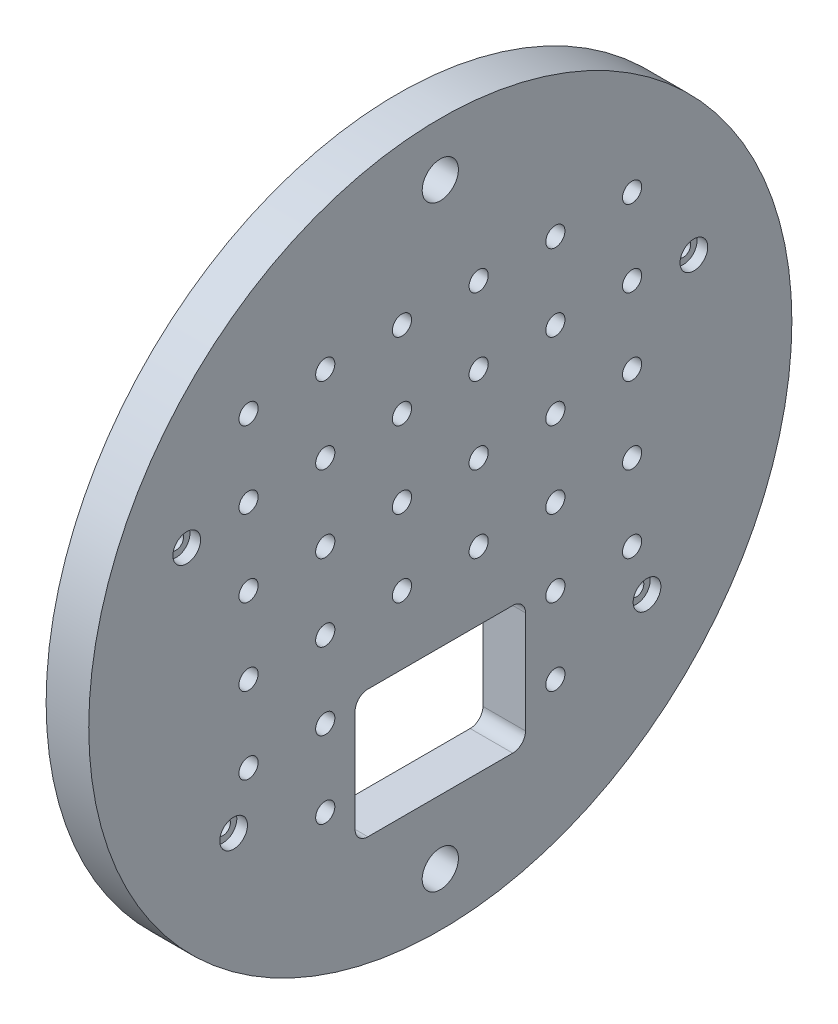
from build123d import *

# Parameters (mm, degrees)
SKETCH_1_R                  = 82.5
EXTRUDE_1_DEPTH             = 10
HOLE_WIZARD_508_D           = 3.5
HOLE_WIZARD_508_CBORE_D     = 6.5
HOLE_WIZARD_508_CBORE_DEPTH = 2.5
SKETCH_5_R                  = 4.25
CUT_EXTRUDE_867_DEPTH       = 118.100384286
CUT_EXTRUDE_1205_REACH      = 119.1
CUT_EXTRUDE_1_REACH         = 119.1
SKETCH_10_R                 = 2.25
PATTERN_LINEAR_1_COUNT      = 6
PATTERN_LINEAR_1_PITCH      = 18
PATTERN_LINEAR_1_COUNT_DIR2 = 6
PATTERN_LINEAR_1_PITCH_DIR2 = 18
WRAP_START                  = -0.3
WRAP_1_DEPTH                = 0.3


# Read off the part's stored shape, not the designer's step: 包覆1
with BuildPart() as part:
    # 草圖1 → 填料-伸長1 (new body)
    with BuildSketch(Plane(origin=(0, 0, 0), x_dir=(0, 0, -1), z_dir=(1, 0, 0))):
        Circle(SKETCH_1_R)
    extrude(amount=EXTRUDE_1_DEPTH)

    # Hole Wizard 508 (through all)
    with Locations(Plane(origin=(10, 25, -59.5), x_dir=(0, 0, 1), z_dir=(1, 0, 0))):
        with Locations((0, 0), (119, 0), (108, 63.5), (11, 63.5)):
            CounterBoreHole(HOLE_WIZARD_508_D / 2, HOLE_WIZARD_508_CBORE_D / 2, HOLE_WIZARD_508_CBORE_DEPTH)

    # 草圖5 → Cut-Extrude 867 (cut, through all)
    with BuildSketch(Plane.ZY.offset(-10)):
        with Locations((0, 70)):
            Circle(SKETCH_5_R)
        with Locations(Location((0, -70, 0), (0, 0, 180))):
            Circle(SKETCH_5_R)
    extrude(amount=CUT_EXTRUDE_867_DEPTH, mode=Mode.SUBTRACT)

    # 草圖7 → Cut-Extrude 1205 (cut, up to next)
    with BuildSketch(Plane(origin=(10, 0, 0), x_dir=(0, 0, -1), z_dir=(1, 0, 0)), mode=Mode.PRIVATE) as cut_extrude_1205_sk1:
        with BuildLine():
            Line((-17, -25), (17, -25))
            ThreePointArc((17, -25), (19.121320344, -25.878679656), (20, -28))
            Line((20, -28), (20, -52))
            ThreePointArc((20, -52), (19.121320344, -54.121320344), (17, -55))
            Line((17, -55), (-17, -55))
            ThreePointArc((-17, -55), (-19.121320344, -54.121320344), (-20, -52))
            Line((-20, -52), (-20, -28))
            ThreePointArc((-20, -28), (-19.121320344, -25.878679656), (-17, -25))
        make_face()
    cut_extrude_1205_tool1 = extrude(cut_extrude_1205_sk1.sketch, amount=-CUT_EXTRUDE_1205_REACH, mode=Mode.PRIVATE) & part.part
    add(cut_extrude_1205_tool1.solids().sort_by_distance((10, -40, 0))[0], mode=Mode.SUBTRACT)

    # 草圖10 → 除料-伸長1 (cut, up to next)
    with BuildSketch(Plane(origin=(10, 0, 0), x_dir=(0, 0, -1), z_dir=(1, 0, 0)), mode=Mode.PRIVATE) as cut_extrude_1_sk1:
        with Locations((45, 45)):
            Circle(SKETCH_10_R)
    cut_extrude_1_tool1 = extrude(cut_extrude_1_sk1.sketch, amount=-CUT_EXTRUDE_1_REACH, mode=Mode.PRIVATE) & part.part
    cut_extrude_1 = cut_extrude_1_tool1.solids().sort_by_distance((10, 45, -45))[0]
    add(cut_extrude_1, mode=Mode.SUBTRACT)

    # 直線複製排列1: Cut-Extrude 1 6 × 6, 6 skipped
    with Locations(*[(0, -j * PATTERN_LINEAR_1_PITCH_DIR2, i * PATTERN_LINEAR_1_PITCH) for i in range(PATTERN_LINEAR_1_COUNT) for j in range(PATTERN_LINEAR_1_COUNT_DIR2) if (i, j) not in ((0, 0), (0, 5), (2, 4), (2, 5), (3, 4), (3, 5), (5, 5))]):
        add(cut_extrude_1, mode=Mode.SUBTRACT)

    # 包覆1 outline → 包覆1 (cut)
    # profile 1 of 5: a face of its own
    with BuildSketch(Plane.ZY.offset(WRAP_START)):
        with BuildLine():
            add(Edge.make_bspline(
                [(4.361103869, -62.576923077), (4.363151022, -62.535252189), (4.367171576, -62.453411675), (4.385999866, -62.334087768), (4.412940743, -62.220032969), (4.451032197, -62.112163055), (4.498338475, -62.009524248), (4.555068502, -61.912524233), (4.622262352, -61.821533044), (4.698469086, -61.737394201), (4.781237726, -61.66020663), (4.870543665, -61.593551387), (4.964388692, -61.537233716), (5.062488091, -61.490152474), (5.165948655, -61.454812628), (5.273831513, -61.428590988), (5.386610649, -61.412814643), (5.463450671, -61.411118857), (5.502530151, -61.41025641)],
                knots=[0, 0, 0, 0, 0.068790794, 0.135103289, 0.198978674, 0.2619043, 0.323494969, 0.385195378, 0.446969239, 0.509764777, 0.572250569, 0.633405176, 0.693251163, 0.752583163, 0.812579266, 0.873275085, 0.935549943, 1, 1, 1, 1], degree=3))
            Line((4.361103869, -62.576923077), (4.675206433, -62.576923077))
            add(Edge.make_bspline(
                [(5.48640435, -61.769230769), (5.459033517, -61.769945801), (5.405281721, -61.771350007), (5.326362688, -61.781172671), (5.251076911, -61.798118511), (5.179235008, -61.821295186), (5.110715422, -61.850753734), (5.045851378, -61.887445479), (4.984788488, -61.931228972), (4.927411965, -61.980869529), (4.874547986, -62.03613713), (4.82810111, -62.097747093), (4.787517096, -62.164574508), (4.752107863, -62.236439059), (4.723352173, -62.313992839), (4.701379022, -62.396960544), (4.683992175, -62.484981925), (4.678183655, -62.54576701), (4.675206433, -62.576923077)],
                knots=[0, 0, 0, 0, 0.064438672, 0.126546911, 0.186887153, 0.245877536, 0.304040885, 0.362191218, 0.420975933, 0.480660283, 0.540600275, 0.600689098, 0.66193579, 0.724442506, 0.789038394, 0.856313757, 0.926352028, 1, 1, 1, 1], degree=3))
            add(Edge.make_bspline(
                [(6.245719254, -62.478766026), (6.245083512, -62.454884627), (6.243830586, -62.407818977), (6.232772888, -62.338813218), (6.216062382, -62.272248404), (6.192117124, -62.207919785), (6.160510384, -62.146474133), (6.122037004, -62.087836653), (6.07764694, -62.031147687), (6.026295671, -61.977994389), (5.969884151, -61.929313184), (5.910289902, -61.886189098), (5.847239798, -61.850149988), (5.780999675, -61.820606491), (5.711754206, -61.797431109), (5.639369461, -61.78137253), (5.564045445, -61.771290046), (5.512611949, -61.769925874), (5.48640435, -61.769230769)],
                knots=[0, 0, 0, 0, 0.061965401, 0.122121906, 0.180988497, 0.239933216, 0.299905831, 0.359988847, 0.421775742, 0.486575826, 0.551534805, 0.615017543, 0.677258617, 0.739729962, 0.803050103, 0.866495132, 0.931973474, 1, 1, 1, 1], degree=3))
            add(Edge.make_bspline(
                [(5.583860279, -63.551482372), (5.616908166, -63.516984065), (5.680386393, -63.450719879), (5.77016897, -63.353976919), (5.850807959, -63.264227378), (5.922825351, -63.181640829), (5.984658857, -63.105009262), (6.039531089, -63.036814558), (6.08349668, -62.974060108), (6.131212075, -62.901319494), (6.177426057, -62.812507177), (6.217138413, -62.703973487), (6.241353261, -62.592246235), (6.244258097, -62.516744198), (6.245719254, -62.478766026)],
                knots=[0, 0, 0, 0, 0.110802644, 0.212829202, 0.30610131, 0.390647321, 0.466924469, 0.534481039, 0.593586941, 0.644557005, 0.736200453, 0.825024026, 0.911985585, 1, 1, 1, 1], degree=3))
            Line((5.583860279, -63.551482372), (4.226488485, -65))
            Line((4.226488485, -65), (6.604693613, -65))
            Line((6.604693613, -65), (6.604693613, -64.641025641))
            Line((6.604693613, -64.641025641), (4.975987683, -64.641025641))
            Line((4.975987683, -64.641025641), (5.851688805, -63.706430288))
            add(Edge.make_bspline(
                [(6.559821818, -62.450721154), (6.558128555, -62.499468988), (6.554771744, -62.596109202), (6.526057367, -62.738124065), (6.481210856, -62.875717484), (6.427213499, -62.986454786), (6.372741055, -63.07568828), (6.323653548, -63.149156985), (6.266188737, -63.228262453), (6.199510239, -63.31273979), (6.124997366, -63.403250696), (6.041975203, -63.499740491), (5.949851721, -63.601212261), (5.88519322, -63.670517862), (5.851688805, -63.706430288)],
                knots=[0, 0, 0, 0, 0.098702196, 0.195672309, 0.292422427, 0.391342544, 0.444462441, 0.504228775, 0.570352338, 0.642545753, 0.722287505, 0.807921123, 0.900469538, 1, 1, 1, 1], degree=3))
            add(Edge.make_bspline(
                [(5.502530151, -61.41025641), (5.540908225, -61.411154867), (5.61631977, -61.412920302), (5.726381784, -61.428081331), (5.831159079, -61.451826922), (5.930446845, -61.485142339), (6.02345291, -61.529926766), (6.110875955, -61.583724305), (6.193756765, -61.645944136), (6.268363549, -61.71919795), (6.336871628, -61.797400334), (6.395973883, -61.880888238), (6.446587047, -61.967117523), (6.488774727, -62.056745725), (6.519830866, -62.150616753), (6.543409074, -62.247363956), (6.556736487, -62.347988767), (6.558781911, -62.416095323), (6.559821818, -62.450721154)],
                knots=[0, 0, 0, 0, 0.06947546, 0.136516798, 0.200788824, 0.263829673, 0.325735023, 0.387290692, 0.449509219, 0.51296782, 0.576275215, 0.6375801, 0.697902606, 0.757172088, 0.816598528, 0.876653171, 0.937289642, 1, 1, 1, 1], degree=3))
        make_face()
    # profile 2 of 5: a face of its own
    with BuildSketch(Plane.ZY.offset(WRAP_START)):
        with BuildLine():
            add(Edge.make_bspline(
                [(3.688026946, -64.338842147), (3.665790351, -64.378285479), (3.622526742, -64.455026582), (3.548125995, -64.560458442), (3.470133922, -64.655306158), (3.385029954, -64.737035812), (3.295360275, -64.808287197), (3.20062762, -64.870625022), (3.100338802, -64.923743542), (2.994489078, -64.96849607), (2.882189527, -65.002905564), (2.76316801, -65.027209785), (2.637196515, -65.042233054), (2.550850335, -65.043978194), (2.506636722, -65.044871795)],
                knots=[0, 0, 0, 0, 0.093369857, 0.181660766, 0.265874227, 0.346354784, 0.424599862, 0.501903184, 0.579992091, 0.658443431, 0.738672236, 0.821894148, 0.908800792, 1, 1, 1, 1], degree=3))
            Line((3.688026946, -64.338842147), (3.408980472, -64.192307692))
            add(Edge.make_bspline(
                [(2.467373901, -64.730769231), (2.498725049, -64.730161174), (2.56093174, -64.728954673), (2.653572597, -64.717222762), (2.744712125, -64.698252487), (2.833973108, -64.672362496), (2.919543954, -64.640785644), (2.998789504, -64.602682787), (3.071669719, -64.56053304), (3.139786686, -64.512323365), (3.205857679, -64.453315178), (3.271400166, -64.379679457), (3.341676819, -64.292591929), (3.385666412, -64.227046263), (3.408980472, -64.192307692)],
                knots=[0, 0, 0, 0, 0.082592263, 0.163878894, 0.24565874, 0.327725695, 0.408609961, 0.485749086, 0.559169056, 0.630268476, 0.705306028, 0.792064966, 0.889796437, 1, 1, 1, 1], degree=3))
            add(Edge.make_bspline(
                [(1.534180792, -63.788461538), (1.535720399, -63.822162003), (1.538747973, -63.888432606), (1.552863116, -63.98540339), (1.57511189, -64.077776732), (1.606380952, -64.164859774), (1.644247798, -64.247789901), (1.690633514, -64.325951938), (1.745973068, -64.398989868), (1.807698768, -64.467557006), (1.876405863, -64.528617767), (1.94868861, -64.583269543), (2.025582175, -64.62907514), (2.106480259, -64.66625503), (2.191252044, -64.695361346), (2.279924239, -64.715229166), (2.372322355, -64.728536273), (2.435308089, -64.730015939), (2.467373901, -64.730769231)],
                knots=[0, 0, 0, 0, 0.068384615, 0.134475588, 0.198391058, 0.260753477, 0.321829223, 0.383037238, 0.444653123, 0.507398011, 0.569825238, 0.630777641, 0.690928687, 0.750945133, 0.811049477, 0.872330853, 0.935004094, 1, 1, 1, 1], degree=3))
            Line((1.534180792, -63.788461538), (3.822642331, -63.788461538))
            add(Edge.make_bspline(
                [(3.544296978, -62.900841346), (3.566423917, -62.931044928), (3.61053051, -62.991251046), (3.66577761, -63.089422203), (3.713735005, -63.192132798), (3.752067966, -63.301043095), (3.783107467, -63.414862675), (3.805564286, -63.53440522), (3.818733904, -63.659635131), (3.821322602, -63.744961686), (3.822642331, -63.788461538)],
                knots=[0, 0, 0, 0, 0.11852184, 0.236254763, 0.356174434, 0.477249655, 0.601539871, 0.729618382, 0.862158266, 1, 1, 1, 1], degree=3))
            add(Edge.make_bspline(
                [(2.514349062, -62.397435897), (2.566796667, -62.398789946), (2.669686913, -62.401446282), (2.819719034, -62.426072615), (2.96167975, -62.46512517), (3.095512255, -62.52027896), (3.221230115, -62.591438512), (3.338016165, -62.679580353), (3.447867678, -62.781998441), (3.511776256, -62.86076165), (3.544296978, -62.900841346)],
                knots=[0, 0, 0, 0, 0.132040234, 0.259032841, 0.381879824, 0.502258444, 0.62275219, 0.744742632, 0.870108927, 1, 1, 1, 1], degree=3))
            add(Edge.make_bspline(
                [(1.514549382, -62.874198718), (1.546257065, -62.836329848), (1.608668011, -62.761791697), (1.714224367, -62.663853372), (1.828524563, -62.581809596), (1.950136189, -62.51380246), (2.080472663, -62.462128813), (2.217781954, -62.423621231), (2.363627541, -62.40204322), (2.463332761, -62.398995386), (2.514349062, -62.397435897)],
                knots=[0, 0, 0, 0, 0.128835254, 0.253589335, 0.374643257, 0.495340042, 0.616324775, 0.739759335, 0.86684232, 1, 1, 1, 1], degree=3))
            add(Edge.make_bspline(
                [(1.220078228, -63.728165064), (1.22113737, -63.688870234), (1.223236448, -63.610993069), (1.236467235, -63.495727524), (1.259915528, -63.383699072), (1.292091852, -63.274814624), (1.333643098, -63.16925649), (1.384475318, -63.066960426), (1.444667695, -62.968035287), (1.491140369, -62.905632153), (1.514549382, -62.874198718)],
                knots=[0, 0, 0, 0, 0.128044808, 0.2537679, 0.377428427, 0.500550841, 0.623295883, 0.746578332, 0.872347541, 1, 1, 1, 1], degree=3))
            add(Edge.make_bspline(
                [(2.506636722, -65.044871795), (2.457494744, -65.04372462), (2.361632983, -65.041486813), (2.222093235, -65.022194348), (2.090713817, -64.99072199), (1.967502114, -64.946756448), (1.852759861, -64.889329124), (1.746259006, -64.819369642), (1.64743948, -64.737237388), (1.559415271, -64.642220944), (1.480171389, -64.540538987), (1.410245569, -64.434583102), (1.351788138, -64.324619878), (1.304235527, -64.211349354), (1.265830662, -64.09548546), (1.239063959, -63.975973993), (1.223634211, -63.853138408), (1.221269765, -63.770041073), (1.220078228, -63.728165064)],
                knots=[0, 0, 0, 0, 0.071578658, 0.139629225, 0.204796697, 0.268134963, 0.329813747, 0.391301398, 0.453433515, 0.51655169, 0.579631271, 0.641118921, 0.701294047, 0.760810336, 0.819931722, 0.878919575, 0.938982822, 1, 1, 1, 1], degree=3))
        make_face()
        with BuildLine():
            add(Edge.make_bspline(
                [(2.530474863, -62.711538462), (2.499125424, -62.712150133), (2.437154175, -62.713359279), (2.345853107, -62.724829408), (2.258173408, -62.743789253), (2.173468121, -62.76975421), (2.092847252, -62.804362812), (2.014652484, -62.844946039), (1.940872088, -62.894487623), (1.894730792, -62.932246478), (1.871420376, -62.951322115)],
                knots=[0, 0, 0, 0, 0.131091976, 0.259141276, 0.384161763, 0.505991952, 0.629098089, 0.750669123, 0.874038938, 1, 1, 1, 1], degree=3))
            add(Edge.make_bspline(
                [(3.508539767, -63.474358974), (3.497043142, -63.432696101), (3.474915841, -63.35250848), (3.428679476, -63.24146759), (3.376607935, -63.142779689), (3.314986204, -63.057200056), (3.245167478, -62.981196543), (3.164522296, -62.914777957), (3.074086402, -62.855360506), (2.974327262, -62.805208007), (2.868685477, -62.762518148), (2.758079285, -62.733893032), (2.645221497, -62.71428349), (2.56888721, -62.712457382), (2.530474863, -62.711538462)],
                knots=[0, 0, 0, 0, 0.096240125, 0.185231261, 0.267500523, 0.344400382, 0.419594869, 0.496890627, 0.576637919, 0.660267852, 0.745386615, 0.830040327, 0.914474212, 1, 1, 1, 1], degree=3))
            Line((3.508539767, -63.474358974), (1.567133517, -63.474358974))
            add(Edge.make_bspline(
                [(1.871420376, -62.951322115), (1.854727094, -62.966416431), (1.820943959, -62.996963647), (1.775803438, -63.049592854), (1.732582965, -63.106344416), (1.693249313, -63.16938954), (1.657171726, -63.238010319), (1.623411749, -63.311627955), (1.593025337, -63.390801085), (1.575929227, -63.445973524), (1.567133517, -63.474358974)],
                knots=[0, 0, 0, 0, 0.109983845, 0.222580497, 0.338499871, 0.458708565, 0.585535346, 0.717517743, 0.85466682, 1, 1, 1, 1], degree=3))
        make_face(mode=Mode.SUBTRACT)
    # profile 3 of 5: a face of its own
    with BuildSketch(Plane.ZY.offset(WRAP_START)):
        with BuildLine():
            add(Edge.make_bspline(
                [(0.423603869, -62.980769231), (0.405213366, -62.959456084), (0.36975864, -62.918366847), (0.313527159, -62.863429781), (0.257503555, -62.817292842), (0.202454742, -62.778340583), (0.146996473, -62.748891436), (0.091779555, -62.727396574), (0.036746816, -62.714094769), (-3.9219e-05, -62.71238033), (-0.018102862, -62.711538462)],
                knots=[0, 0, 0, 0, 0.158223098, 0.305035505, 0.441308964, 0.565963227, 0.683525114, 0.79333413, 0.898517512, 1, 1, 1, 1], degree=3))
            Line((0.423603869, -62.980769231), (0.636744895, -62.761318109))
            add(Edge.make_bspline(
                [(-0.018102862, -62.397435897), (0.009089202, -62.398540238), (0.063983424, -62.400769636), (0.14633805, -62.418475326), (0.228571392, -62.447608431), (0.310894742, -62.487844664), (0.392705031, -62.53991154), (0.474721888, -62.602840839), (0.557929918, -62.676218554), (0.609886231, -62.732317779), (0.636744895, -62.761318109)],
                knots=[0, 0, 0, 0, 0.105714261, 0.213411613, 0.32612673, 0.444451672, 0.56906108, 0.702712204, 0.846317947, 1, 1, 1, 1], degree=3))
            add(Edge.make_bspline(
                [(-0.664537156, -63.068409455), (-0.664002961, -63.044784057), (-0.662957465, -62.998545806), (-0.654613414, -62.930606986), (-0.639421702, -62.866058832), (-0.62036678, -62.803931969), (-0.593883775, -62.745429875), (-0.56223787, -62.689772404), (-0.525050445, -62.637036486), (-0.482207154, -62.588033354), (-0.435100509, -62.543524028), (-0.384205739, -62.5047254), (-0.330667483, -62.471619045), (-0.274259063, -62.443853884), (-0.21443859, -62.422852502), (-0.151624204, -62.408395117), (-0.085943049, -62.398739914), (-0.041041923, -62.397876829), (-0.018102862, -62.397435897)],
                knots=[0, 0, 0, 0, 0.06797849, 0.133043535, 0.196507438, 0.258613417, 0.319728338, 0.380872854, 0.442635602, 0.505079304, 0.56788052, 0.628813854, 0.688910091, 0.748765006, 0.809385783, 0.870884336, 0.934037463, 1, 1, 1, 1], degree=3))
            add(Edge.make_bspline(
                [(-0.547449817, -63.462439904), (-0.565580416, -63.433294289), (-0.601847952, -63.374992874), (-0.637063143, -63.277682397), (-0.661269172, -63.175237339), (-0.663431562, -63.104550485), (-0.664537156, -63.068409455)],
                knots=[0, 0, 0, 0, 0.246252371, 0.492590796, 0.740569991, 1, 1, 1, 1], degree=3))
            add(Edge.make_bspline(
                [(-0.106444208, -63.811598558), (-0.132490848, -63.797059426), (-0.183003595, -63.76886341), (-0.254550886, -63.724947329), (-0.31909824, -63.680280055), (-0.378198815, -63.637367216), (-0.430359821, -63.593946272), (-0.475375769, -63.54996902), (-0.515018985, -63.507209034), (-0.536966396, -63.476911737), (-0.547449817, -63.462439904)],
                knots=[0, 0, 0, 0, 0.157761664, 0.305950213, 0.443775499, 0.572824362, 0.692154156, 0.802295707, 0.905564392, 1, 1, 1, 1], degree=3))
            add(Edge.make_bspline(
                [(0.281276145, -64.075220353), (0.27325375, -64.06618499), (0.255778078, -64.046502708), (0.223722837, -64.01807763), (0.185340975, -63.98743953), (0.140200812, -63.955107941), (0.08821135, -63.921509336), (0.029161874, -63.886819984), (-0.036138678, -63.849392258), (-0.08230931, -63.824572603), (-0.106444208, -63.811598558)],
                knots=[0, 0, 0, 0, 0.076875074, 0.167461676, 0.272270023, 0.389550841, 0.520801368, 0.666263293, 0.825544915, 1, 1, 1, 1], degree=3))
            add(Edge.make_bspline(
                [(0.367514126, -64.319210737), (0.366427831, -64.296901119), (0.364283089, -64.252853763), (0.347439817, -64.189103422), (0.320826964, -64.128634141), (0.294622316, -64.093244494), (0.281276145, -64.075220353)],
                knots=[0, 0, 0, 0, 0.253475435, 0.500453315, 0.745578135, 1, 1, 1, 1], degree=3))
            add(Edge.make_bspline(
                [(-0.08400831, -64.730769231), (-0.053690384, -64.729398406), (0.005545757, -64.726720044), (0.090389516, -64.702402952), (0.168728142, -64.664273), (0.236751488, -64.610188302), (0.294653649, -64.547232729), (0.336581823, -64.47631861), (0.362857999, -64.399527153), (0.365943997, -64.346294851), (0.367514126, -64.319210737)],
                knots=[0, 0, 0, 0, 0.134042046, 0.261895674, 0.387836045, 0.517686206, 0.644508654, 0.764718263, 0.880290782, 1, 1, 1, 1], degree=3))
            add(Edge.make_bspline(
                [(-0.590919368, -64.461538462), (-0.571146955, -64.482893226), (-0.532815143, -64.524292666), (-0.471513926, -64.579417007), (-0.409134525, -64.625618278), (-0.346299838, -64.664261693), (-0.282079744, -64.694037096), (-0.21683413, -64.71495569), (-0.150695706, -64.728399882), (-0.10627357, -64.729978164), (-0.08400831, -64.730769231)],
                knots=[0, 0, 0, 0, 0.147475818, 0.285904172, 0.417171648, 0.540500744, 0.659237718, 0.775006098, 0.887228573, 1, 1, 1, 1], degree=3))
            Line((-0.590919368, -64.461538462), (-0.799152541, -64.698517628))
            add(Edge.make_bspline(
                [(-0.067882509, -65.044871795), (-0.103249684, -65.043879095), (-0.173492611, -65.041907487), (-0.277382331, -65.023401426), (-0.378903089, -64.994606032), (-0.477286629, -64.954890098), (-0.570332743, -64.904739385), (-0.655463668, -64.844676992), (-0.73297513, -64.776686994), (-0.777093404, -64.724574084), (-0.799152541, -64.698517628)],
                knots=[0, 0, 0, 0, 0.126742519, 0.251723961, 0.377218688, 0.504693549, 0.631458239, 0.755401067, 0.877700534, 1, 1, 1, 1], degree=3))
            add(Edge.make_bspline(
                [(0.68161669, -64.305889423), (0.680897156, -64.331158569), (0.679479236, -64.380954182), (0.669621169, -64.454289012), (0.652666193, -64.52442357), (0.629572439, -64.592118854), (0.598388066, -64.656077794), (0.561840269, -64.717914043), (0.517965357, -64.776289974), (0.467873981, -64.831128934), (0.413028487, -64.881214681), (0.354522349, -64.925238635), (0.292283518, -64.961812972), (0.226756717, -64.992078318), (0.157793063, -65.016146576), (0.085381774, -65.032809107), (0.009753019, -65.042781868), (-0.041676789, -65.044166344), (-0.067882509, -65.044871795)],
                knots=[0, 0, 0, 0, 0.064548126, 0.127199133, 0.188597338, 0.248639515, 0.309524699, 0.370036991, 0.431889244, 0.495704286, 0.559519328, 0.62137158, 0.682397107, 0.743568482, 0.805498484, 0.868639701, 0.933066225, 1, 1, 1, 1], degree=3))
            add(Edge.make_bspline(
                [(0.562425985, -63.910456731), (0.580636512, -63.940122819), (0.616878841, -63.99916384), (0.654937108, -64.096382267), (0.676997383, -64.19949277), (0.680059603, -64.27002499), (0.68161669, -64.305889423)],
                knots=[0, 0, 0, 0, 0.248838614, 0.495235025, 0.743335604, 1, 1, 1, 1], degree=3))
            add(Edge.make_bspline(
                [(0.101788965, -63.551482372), (0.129002542, -63.566727275), (0.181570213, -63.596175407), (0.25626298, -63.641885111), (0.324050021, -63.687316535), (0.385505688, -63.731983809), (0.439447497, -63.777136676), (0.48751205, -63.821044433), (0.528500494, -63.865033742), (0.551454421, -63.895766855), (0.562425985, -63.910456731)],
                knots=[0, 0, 0, 0, 0.158989101, 0.307114592, 0.446213159, 0.574876072, 0.69415211, 0.80458118, 0.906593319, 1, 1, 1, 1], degree=3))
            add(Edge.make_bspline(
                [(-0.26349549, -63.287860577), (-0.255531996, -63.297645161), (-0.238582703, -63.318470416), (-0.206774188, -63.347374269), (-0.170751685, -63.37931652), (-0.127431748, -63.411253357), (-0.07868072, -63.444885082), (-0.023441435, -63.478887215), (0.036533069, -63.51585164), (0.079470376, -63.539296076), (0.101788965, -63.551482372)],
                knots=[0, 0, 0, 0, 0.083425105, 0.177559821, 0.28398236, 0.402216747, 0.53356848, 0.676120994, 0.831649373, 1, 1, 1, 1], degree=3))
            add(Edge.make_bspline(
                [(-0.350434592, -63.055789263), (-0.34932378, -63.076001307), (-0.347105287, -63.116368418), (-0.329858608, -63.175916452), (-0.302392535, -63.23397349), (-0.276722341, -63.269536396), (-0.26349549, -63.287860577)],
                knots=[0, 0, 0, 0, 0.240039931, 0.479403194, 0.731756739, 1, 1, 1, 1], degree=3))
            add(Edge.make_bspline(
                [(-0.018102862, -62.711538462), (-0.040242251, -62.712613335), (-0.083809437, -62.714728532), (-0.146235256, -62.735841963), (-0.204185881, -62.768250701), (-0.254342861, -62.814219285), (-0.296830541, -62.866983554), (-0.327844222, -62.925979878), (-0.346810205, -62.989427922), (-0.349214937, -63.03345778), (-0.350434592, -63.055789263)],
                knots=[0, 0, 0, 0, 0.124958493, 0.245900629, 0.36916603, 0.498510841, 0.628503866, 0.751028329, 0.873724174, 1, 1, 1, 1], degree=3))
        make_face()
    # profile 4 of 5: a face of its own
    with BuildSketch(Plane.ZY.offset(WRAP_START)):
        with BuildLine():
            add(Edge.make_bspline(
                [(-1.606844849, -64.557592147), (-1.642263639, -64.597631741), (-1.711383855, -64.675769512), (-1.826824973, -64.777851685), (-1.949193151, -64.862230007), (-2.077894472, -64.930379922), (-2.212812715, -64.981571979), (-2.353648802, -65.017958138), (-2.500460183, -65.041351973), (-2.600712538, -65.043687995), (-2.651516323, -65.044871795)],
                knots=[0, 0, 0, 0, 0.134298379, 0.262084975, 0.386269912, 0.507164597, 0.627300236, 0.748144942, 0.872370177, 1, 1, 1, 1], degree=3))
            Line((-1.606844849, -64.557592147), (-1.606844849, -65))
            Line((-1.606844849, -65), (-1.292742285, -65))
            Line((-1.292742285, -65), (-1.292742285, -62.442307692))
            Line((-1.292742285, -62.442307692), (-1.606844849, -62.442307692))
            Line((-1.606844849, -62.442307692), (-1.606844849, -62.915564904))
            add(Edge.make_bspline(
                [(-2.641700618, -62.397435897), (-2.589500759, -62.398873649), (-2.487139299, -62.401693012), (-2.33741129, -62.425155739), (-2.195766812, -62.464794206), (-2.06111246, -62.518711704), (-1.933931774, -62.590360433), (-1.815428789, -62.680740394), (-1.704363306, -62.789281581), (-1.639983014, -62.872652026), (-1.606844849, -62.915564904)],
                knots=[0, 0, 0, 0, 0.129862142, 0.254653531, 0.376014554, 0.495255252, 0.614797719, 0.738105554, 0.8651963, 1, 1, 1, 1], degree=3))
            add(Edge.make_bspline(
                [(-3.985049977, -63.714142628), (-3.983797006, -63.669678925), (-3.981319949, -63.581776581), (-3.962866729, -63.452497883), (-3.93183572, -63.327979623), (-3.888287873, -63.208622679), (-3.832445918, -63.094282629), (-3.764517831, -62.984878604), (-3.684498706, -62.880109207), (-3.592246299, -62.78243798), (-3.492311529, -62.692217366), (-3.385402798, -62.61380832), (-3.274179516, -62.546091471), (-3.156916506, -62.492437995), (-3.035349401, -62.449028891), (-2.908395955, -62.418995922), (-2.776584377, -62.401298601), (-2.687093885, -62.398735837), (-2.641700618, -62.397435897)],
                knots=[0, 0, 0, 0, 0.063774532, 0.12607881, 0.186904093, 0.247573935, 0.308003356, 0.369131898, 0.432033228, 0.496790794, 0.561610823, 0.624913866, 0.686726349, 0.748078833, 0.809582291, 0.871630743, 0.934885821, 1, 1, 1, 1], degree=3))
            add(Edge.make_bspline(
                [(-2.651516323, -65.044871795), (-2.696684277, -65.043645423), (-2.785757482, -65.041226962), (-2.916786559, -65.022464659), (-3.042878808, -64.992334037), (-3.164153381, -64.950433147), (-3.279825526, -64.894852326), (-3.390885623, -64.828311078), (-3.496758315, -64.749070248), (-3.595829854, -64.658482219), (-3.687061855, -64.560087232), (-3.767123127, -64.455141685), (-3.833876207, -64.344099381), (-3.889696288, -64.228366227), (-3.932692632, -64.107051308), (-3.962666266, -63.98057414), (-3.981406713, -63.849084266), (-3.983824174, -63.759544743), (-3.985049977, -63.714142628)],
                knots=[0, 0, 0, 0, 0.064619991, 0.127433484, 0.189004127, 0.249930071, 0.310668454, 0.372328961, 0.43493911, 0.499575544, 0.564191208, 0.626735217, 0.688109334, 0.749293607, 0.810330528, 0.87190117, 0.935045915, 1, 1, 1, 1], degree=3))
        make_face()
        with BuildLine():
            add(Edge.make_bspline(
                [(-3.670947413, -63.717648237), (-3.66908252, -63.761238344), (-3.665360043, -63.8482477), (-3.638609348, -63.977228277), (-3.593729475, -64.102882319), (-3.532487412, -64.224143313), (-3.455800787, -64.336727413), (-3.366912135, -64.438467536), (-3.264961853, -64.525957124), (-3.152034346, -64.599194697), (-3.031426376, -64.658357218), (-2.904592445, -64.699522858), (-2.773916806, -64.726100638), (-2.685064473, -64.729205115), (-2.640298374, -64.730769231)],
                knots=[0, 0, 0, 0, 0.081589349, 0.162858895, 0.245483689, 0.330807139, 0.416493374, 0.499893203, 0.583048156, 0.667157852, 0.751311929, 0.833784789, 0.916256489, 1, 1, 1, 1], degree=3))
            add(Edge.make_bspline(
                [(-2.637493887, -62.711538462), (-2.683408225, -62.713172099), (-2.774035825, -62.71639664), (-2.907079827, -62.741570135), (-3.034393241, -62.78345473), (-3.155339315, -62.840736631), (-3.268007532, -62.912765368), (-3.368701203, -62.999886751), (-3.458243904, -63.099723765), (-3.533552168, -63.211825875), (-3.594942665, -63.332003967), (-3.638109697, -63.457628405), (-3.666578945, -63.586433382), (-3.669487465, -63.673796068), (-3.670947413, -63.717648237)],
                knots=[0, 0, 0, 0, 0.085920517, 0.169593435, 0.252475515, 0.336244477, 0.419504521, 0.502035907, 0.584774648, 0.669846475, 0.754184866, 0.836658238, 0.918009726, 1, 1, 1, 1], degree=3))
            add(Edge.make_bspline(
                [(-1.606844849, -63.726762821), (-1.607804505, -63.69142499), (-1.609693413, -63.621868957), (-1.624123982, -63.519741439), (-1.647078908, -63.422007713), (-1.679425078, -63.328565024), (-1.721916363, -63.239930009), (-1.773164129, -63.155466248), (-1.834069579, -63.075613037), (-1.903652275, -63.001469966), (-1.979817477, -62.933843504), (-2.060412018, -62.873479263), (-2.146390765, -62.82389049), (-2.236307802, -62.782849219), (-2.330319136, -62.750190069), (-2.429189756, -62.728402375), (-2.531868743, -62.713442054), (-2.601914798, -62.712179673), (-2.637493887, -62.711538462)],
                knots=[0, 0, 0, 0, 0.0656338, 0.129188088, 0.191218683, 0.251912818, 0.312507474, 0.373494434, 0.4351516, 0.498741474, 0.562095217, 0.624186567, 0.685475718, 0.746096815, 0.807611636, 0.869966581, 0.933951019, 1, 1, 1, 1], degree=3))
            add(Edge.make_bspline(
                [(-2.640298374, -64.730769231), (-2.594851872, -64.729109267), (-2.504463285, -64.725807763), (-2.371024577, -64.700526498), (-2.241529614, -64.6587577), (-2.117742386, -64.600858573), (-2.002426255, -64.529101217), (-1.898928377, -64.445094126), (-1.811412409, -64.347390942), (-1.737219799, -64.240014489), (-1.679044383, -64.122302492), (-1.636668323, -63.996968302), (-1.611614418, -63.864007553), (-1.608456688, -63.773143626), (-1.606844849, -63.726762821)],
                knots=[0, 0, 0, 0, 0.084802388, 0.16866354, 0.252551924, 0.338239689, 0.423102661, 0.505556051, 0.586175656, 0.66713572, 0.74849918, 0.830452399, 0.913455706, 1, 1, 1, 1], degree=3))
        make_face(mode=Mode.SUBTRACT)
    # profile 5 of 5: a face of its own
    with BuildSketch(Plane.ZY.offset(WRAP_START)):
        with BuildLine():
            add(Edge.make_bspline(
                [(-5.904721451, -61.5), (-5.871292973, -61.50017575), (-5.806500263, -61.500516398), (-5.712280821, -61.50579953), (-5.62403201, -61.513003199), (-5.541728238, -61.524433292), (-5.465407536, -61.538225069), (-5.394839898, -61.554926885), (-5.330249726, -61.574953499), (-5.25313699, -61.60679978), (-5.165216329, -61.654122949), (-5.070017936, -61.724051514), (-4.988613697, -61.809583977), (-4.918427379, -61.906066632), (-4.86262626, -62.012202404), (-4.822256963, -62.125461593), (-4.796699087, -62.244383335), (-4.794070653, -62.326026513), (-4.792742285, -62.36728766)],
                knots=[0, 0, 0, 0, 0.062594097, 0.121322939, 0.176680142, 0.228365096, 0.276868446, 0.321879128, 0.364098625, 0.403355696, 0.477967948, 0.550535461, 0.623584457, 0.698174882, 0.77335367, 0.847281125, 0.92281834, 1, 1, 1, 1], degree=3))
            Line((-5.904721451, -61.5), (-6.587614079, -61.5))
            Line((-6.587614079, -61.5), (-6.587614079, -65))
            Line((-6.587614079, -65), (-5.641099656, -65))
            add(Edge.make_bspline(
                [(-4.523511515, -64.006510417), (-4.524488361, -64.040677289), (-4.526410333, -64.107901567), (-4.540590305, -64.206656701), (-4.564599412, -64.301031648), (-4.597670558, -64.391636831), (-4.640832873, -64.478296965), (-4.693360837, -64.561110229), (-4.755992401, -64.63924456), (-4.82605527, -64.713568183), (-4.905317415, -64.78039597), (-4.99083317, -64.839911677), (-5.08367949, -64.888857739), (-5.182331484, -64.929973761), (-5.2878958, -64.961380959), (-5.399898408, -64.983353533), (-5.51824271, -64.99815857), (-5.599452461, -64.999375775), (-5.641099656, -65)],
                knots=[0, 0, 0, 0, 0.061160277, 0.120334558, 0.178180255, 0.235235126, 0.292682961, 0.351186248, 0.41045661, 0.471719854, 0.533761203, 0.595739024, 0.657887515, 0.72129518, 0.786822515, 0.854686154, 0.925477986, 1, 1, 1, 1], degree=3))
            add(Edge.make_bspline(
                [(-5.19728956, -63.111879006), (-5.157529133, -63.127144005), (-5.081457585, -63.15634973), (-4.976771573, -63.207985194), (-4.886576728, -63.264147304), (-4.810179582, -63.325479154), (-4.744841927, -63.391587965), (-4.687788985, -63.463443079), (-4.639107611, -63.541981837), (-4.597394688, -63.626385373), (-4.564845932, -63.715791841), (-4.540470027, -63.809362617), (-4.526502578, -63.906762172), (-4.524514937, -63.973047552), (-4.523511515, -64.006510417)],
                knots=[0, 0, 0, 0, 0.106057493, 0.202914257, 0.290300165, 0.370222566, 0.446383721, 0.5213969, 0.598291083, 0.676142469, 0.7555287, 0.834887172, 0.916646049, 1, 1, 1, 1], degree=3))
            add(Edge.make_bspline(
                [(-4.792742285, -62.36728766), (-4.793835503, -62.405940216), (-4.79598378, -62.481896133), (-4.81652654, -62.592990242), (-4.848687208, -62.698741461), (-4.893392457, -62.798763846), (-4.951494454, -62.89079746), (-5.020352772, -62.975584726), (-5.103429575, -63.049535783), (-5.165672815, -63.090878685), (-5.19728956, -63.111879006)],
                knots=[0, 0, 0, 0, 0.130569107, 0.256580609, 0.380551617, 0.503622917, 0.625739323, 0.747548582, 0.871766119, 1, 1, 1, 1], degree=3))
        make_face()
        with BuildLine():
            add(Edge.make_bspline(
                [(-5.82619581, -64.641025641), (-5.794176884, -64.640641894), (-5.732464626, -64.639902271), (-5.643363396, -64.637487717), (-5.560780292, -64.631995441), (-5.485092156, -64.623349591), (-5.415481703, -64.613971142), (-5.352784, -64.601359861), (-5.296490807, -64.586910901), (-5.231216499, -64.564576728), (-5.157712991, -64.529880257), (-5.078502135, -64.477566031), (-5.008075916, -64.415242723), (-4.948270657, -64.343111809), (-4.899257669, -64.264680482), (-4.863602214, -64.181535132), (-4.841611357, -64.095049605), (-4.838949188, -64.036082892), (-4.837614079, -64.006510417)],
                knots=[0, 0, 0, 0, 0.072502489, 0.139738989, 0.201795135, 0.259821934, 0.312205989, 0.360773434, 0.404540343, 0.443698099, 0.516840794, 0.587874336, 0.657965418, 0.728969389, 0.79930772, 0.866635778, 0.933116329, 1, 1, 1, 1], degree=3))
            Line((-5.82619581, -64.641025641), (-6.273511515, -64.641025641))
            Line((-6.273511515, -64.641025641), (-6.273511515, -63.33974359))
            Line((-6.273511515, -63.33974359), (-6.065278342, -63.33974359))
            add(Edge.make_bspline(
                [(-5.410430586, -63.381109776), (-5.427459682, -63.377654692), (-5.464382274, -63.370163357), (-5.524589855, -63.362255654), (-5.593325723, -63.355210594), (-5.670748601, -63.349999436), (-5.756956442, -63.344612893), (-5.85213336, -63.342518071), (-5.955890675, -63.340018811), (-6.027883048, -63.339837677), (-6.065278342, -63.33974359)],
                knots=[0, 0, 0, 0, 0.079306486, 0.171952819, 0.277056507, 0.394730576, 0.526177321, 0.671344767, 0.829285257, 1, 1, 1, 1], degree=3))
            add(Edge.make_bspline(
                [(-4.837614079, -64.006510417), (-4.837890184, -63.988017076), (-4.838437939, -63.951328694), (-4.846698554, -63.897412875), (-4.858712424, -63.845187002), (-4.874243858, -63.794509261), (-4.896863325, -63.746295885), (-4.92326987, -63.699593325), (-4.954231271, -63.654339846), (-5.002475437, -63.597127593), (-5.072647422, -63.53121058), (-5.172354197, -63.466673077), (-5.285726495, -63.41462527), (-5.367953988, -63.392525794), (-5.410430586, -63.381109776)],
                knots=[0, 0, 0, 0, 0.060287398, 0.119602355, 0.177503371, 0.235142664, 0.292132593, 0.350871209, 0.410097863, 0.470731522, 0.594828704, 0.722578824, 0.85669139, 1, 1, 1, 1], degree=3))
        make_face(mode=Mode.SUBTRACT)
        with BuildLine():
            add(Edge.make_bspline(
                [(-6.062473855, -62.980769231), (-6.03162506, -62.980369308), (-5.972018901, -62.979596575), (-5.885699004, -62.977383058), (-5.805573986, -62.971185015), (-5.731782153, -62.964988752), (-5.664439709, -62.954914165), (-5.603695847, -62.942922042), (-5.54859725, -62.930239137), (-5.485057705, -62.90866965), (-5.412984756, -62.876791975), (-5.336151652, -62.827320139), (-5.268417183, -62.768395785), (-5.211219995, -62.700404824), (-5.164408524, -62.625538638), (-5.131894809, -62.544991757), (-5.109847525, -62.460771625), (-5.107855994, -62.402953373), (-5.106844849, -62.373597756)],
                knots=[0, 0, 0, 0, 0.072301034, 0.139700332, 0.202288511, 0.260599533, 0.313190329, 0.361738933, 0.405706476, 0.445539985, 0.518831956, 0.58977824, 0.658867479, 0.728430478, 0.797282704, 0.864815377, 0.931363753, 1, 1, 1, 1], degree=3))
            Line((-6.062473855, -62.980769231), (-6.273511515, -62.980769231))
            Line((-6.273511515, -62.980769231), (-6.273511515, -61.858974359))
            Line((-6.273511515, -61.858974359), (-5.847229464, -61.858974359))
            add(Edge.make_bspline(
                [(-5.106844849, -62.373597756), (-5.107371029, -62.354171985), (-5.108403189, -62.316066213), (-5.116856491, -62.260516859), (-5.131224066, -62.208273106), (-5.149678359, -62.158618996), (-5.175467048, -62.113107146), (-5.205830511, -62.07016395), (-5.242516201, -62.031251831), (-5.284273514, -61.994882333), (-5.332282137, -61.962637805), (-5.386513429, -61.934397042), (-5.447701106, -61.911656265), (-5.514813961, -61.891740113), (-5.588885048, -61.877751819), (-5.669059602, -61.866098431), (-5.755994321, -61.860165689), (-5.816139423, -61.859380327), (-5.847229464, -61.858974359)],
                knots=[0, 0, 0, 0, 0.057003133, 0.111817869, 0.164402372, 0.215869805, 0.26684111, 0.317478963, 0.369902136, 0.423400449, 0.479718398, 0.539241497, 0.602430689, 0.671029546, 0.744484798, 0.823453971, 0.908740313, 1, 1, 1, 1], degree=3))
        make_face(mode=Mode.SUBTRACT)
    extrude(amount=WRAP_1_DEPTH, mode=Mode.SUBTRACT)


solid = part.part
